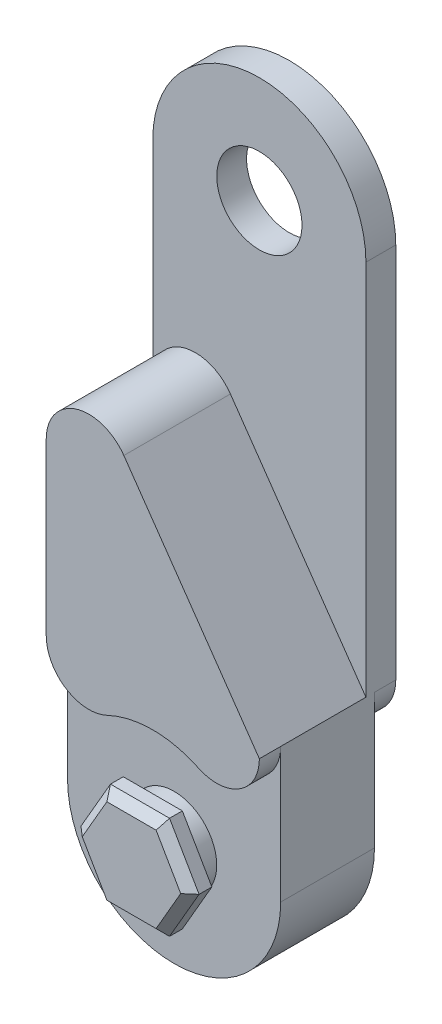
from build123d import *

# Parameters (mm, degrees)
CROQUIS1_R              = 12.5
CROQUIS1_R_2            = 7.5
CROQUIS1_R_3            = 5
SALIENTE_EXTRUIR2_DEPTH = 16
CROQUIS2_R              = 12.5
CROQUIS2_R_2            = 5
CORTAR_EXTRUIR1_DEPTH   = 2.5
REDONDEO2_R             = 5
REDONDEO3_R             = 5
CORTAR_EXTRUIR3_START   = -2.5
CROQUIS3_R              = 12.5
CROQUIS3_R_2            = 5
CORTAR_EXTRUIR3_DEPTH   = 2.5
REDONDEO6_R             = 5
REDONDEO7_R             = 5
SALIENTE_EXTRUIR3_DEPTH = 2.5
SALIENTE_EXTRUIR4_DEPTH = 2.5
CHAFL_N2_SIZE           = 1
CHAFL_N3_SIZE           = 1
CHAFL_N4_SIZE           = 1
CHAFL_N5_SIZE           = 1
CHAFL_N6_SIZE           = 1
CHAFL_N7_SIZE           = 1
CHAFL_N8_SIZE           = 1
CHAFL_N9_SIZE           = 1
CHAFL_N10_SIZE          = 1
CHAFL_N11_SIZE          = 1
CHAFL_N12_SIZE          = 1
CHAFL_N13_SIZE          = 1
CORTAR_EXTRUIR4_START   = -12.5
CORTAR_EXTRUIR4_DEPTH   = 12.5
REDONDEO8_START         = 3.5
REDONDEO8_DEPTH         = 13.5
REDONDEO9_START         = 3.5
REDONDEO9_DEPTH         = 13.5
CORTAR_EXTRUIR5_DEPTH   = 12.5
CORTAR_EXTRUIR6_START   = -12.5
CORTAR_EXTRUIR6_DEPTH   = 12.5
REDONDEO11_R            = 5


with BuildPart() as part:
    # Croquis1 → Saliente-Extruir2 (new body)
    with BuildSketch(Plane.XY):
        with BuildLine():
            ThreePointArc((12.5, 30), (0, 42.5), (-12.5, 30))
            Line((-12.5, 30), (-5, 30))
            ThreePointArc((-5, 30), (0, 35), (5, 30))
            Line((5, 30), (12.5, 30))
        make_face()
        with BuildLine():
            ThreePointArc((5, 30), (0, 35), (-5, 30))
            Line((-5, 30), (5, 30))
        make_face()
        with BuildLine():
            Line((5, 30), (-5, 30))
            ThreePointArc((-5, 30), (0, 25), (5, 30))
        make_face()
        with BuildLine():
            ThreePointArc((-12.5, 30), (-11.180339887, 24.409830056), (-7.5, 20))
            Line((-7.5, 20), (7.5, 20))
            ThreePointArc((7.5, 20), (11.180339887, 24.409830056), (12.5, 30))
            Line((12.5, 30), (5, 30))
            ThreePointArc((5, 30), (0, 25), (-5, 30))
            Line((-5, 30), (-12.5, 30))
        make_face()
        with BuildLine():
            Line((7.5, 20), (-7.5, 20))
            ThreePointArc((-7.5, 20), (0, 17.5), (7.5, 20))
        make_face()
        with BuildLine():
            ThreePointArc((-12.5, -30), (-11.180339887, -24.409830056), (-7.5, -20))
            Line((-7.5, -20), (-7.5, 20))
            ThreePointArc((-7.5, 20), (-11.180339887, 24.409830056), (-12.5, 30))
            Line((-12.5, 30), (-12.5, -30))
        make_face()
        with BuildLine():
            Line((7.5, 20), (7.5, -20))
            ThreePointArc((7.5, -20), (11.180339887, -24.409830056), (12.5, -30))
            Line((12.5, -30), (12.5, 30))
            ThreePointArc((12.5, 30), (11.180339887, 24.409830056), (7.5, 20))
        make_face()
        with BuildLine():
            Line((-7.5, 20), (-7.5, -20))
            ThreePointArc((-7.5, -20), (0, -12.5), (7.5, -20))
            Line((7.5, -20), (7.5, 20))
            ThreePointArc((7.5, 20), (0, 17.5), (-7.5, 20))
        make_face()
        with Locations((0, -30)):
            Circle(CROQUIS1_R)
        with Locations((0, -20)):
            Circle(CROQUIS1_R_2)
        with BuildLine():
            ThreePointArc((7.5, -20), (0, -17.5), (-7.5, -20))
            Line((-7.5, -20), (7.5, -20))
        make_face()
        with BuildLine():
            Line((7.5, -20), (-7.5, -20))
            ThreePointArc((-7.5, -20), (-6.460724191, -23.809073762), (-3.630921887, -26.5625))
            ThreePointArc((-3.630921887, -26.5625), (0, -25), (3.630921887, -26.5625))
            ThreePointArc((3.630921887, -26.5625), (6.460724191, -23.809073762), (7.5, -20))
        make_face()
        with BuildLine():
            ThreePointArc((-3.630921887, -26.5625), (-6.460724191, -23.809073762), (-7.5, -20))
            ThreePointArc((-7.5, -20), (-11.180339887, -24.409830056), (-12.5, -30))
            Line((-12.5, -30), (-5, -30))
            ThreePointArc((-5, -30), (-4.64513775, -28.149947222), (-3.630921887, -26.5625))
        make_face()
        with BuildLine():
            ThreePointArc((12.5, -30), (11.180339887, -24.409830056), (7.5, -20))
            ThreePointArc((7.5, -20), (6.460724191, -23.809073762), (3.630921887, -26.5625))
            ThreePointArc((3.630921887, -26.5625), (4.64513775, -28.149947222), (5, -30))
            Line((5, -30), (12.5, -30))
        make_face()
        with BuildLine():
            Line((-5, -30), (-12.5, -30))
            ThreePointArc((-12.5, -30), (0, -42.5), (12.5, -30))
            Line((12.5, -30), (5, -30))
            ThreePointArc((5, -30), (0, -35), (-5, -30))
        make_face()
        with Locations((0, -30)):
            Circle(CROQUIS1_R_3)
        with BuildLine():
            ThreePointArc((3.630921887, -26.5625), (0, -27.5), (-3.630921887, -26.5625))
            ThreePointArc((-3.630921887, -26.5625), (-4.64513775, -28.149947222), (-5, -30))
            Line((-5, -30), (5, -30))
            ThreePointArc((5, -30), (4.64513775, -28.149947222), (3.630921887, -26.5625))
        make_face()
        with BuildLine():
            Line((5, -30), (-5, -30))
            ThreePointArc((-5, -30), (0, -35), (5, -30))
        make_face()
    extrude(amount=SALIENTE_EXTRUIR2_DEPTH)

    # Croquis2 → Cortar-Extruir1 (cut)
    with BuildSketch(Plane(origin=(0, 0, 0), x_dir=(-1, 0, 0), z_dir=(0, 0, -1))):
        with Locations((0, -30)):
            Circle(CROQUIS2_R)
        with Locations((0, -30)):
            Circle(CROQUIS2_R_2, mode=Mode.SUBTRACT)
    extrude(amount=-CORTAR_EXTRUIR1_DEPTH, mode=Mode.SUBTRACT)

    # Redondeo2
    redondeo2_edges = [part.edges().sort_by_distance(p)[0] for p in [
        (12.5, -30, 1.25),
    ]]
    fillet(redondeo2_edges, radius=REDONDEO2_R)

    # Redondeo3
    redondeo3_edges = [part.edges().sort_by_distance(p)[0] for p in [
        (-12.5, -30, 1.25),
    ]]
    fillet(redondeo3_edges, radius=REDONDEO3_R)

    # Croquis3 → Cortar-Extruir3 (cut)
    with BuildSketch(Plane.XY.offset(16).offset(CORTAR_EXTRUIR3_START)):
        with Locations((0, -30)):
            Circle(CROQUIS3_R)
        with Locations(Location((0, -30, 0), (0, 0, 180))):
            Circle(CROQUIS3_R_2, mode=Mode.SUBTRACT)
    extrude(amount=CORTAR_EXTRUIR3_DEPTH, mode=Mode.SUBTRACT)

    # Redondeo6
    redondeo6_edges = [part.edges().sort_by_distance(p)[0] for p in [
        (12.5, -30, 14.75),
    ]]
    fillet(redondeo6_edges, radius=REDONDEO6_R)

    # Redondeo7
    redondeo7_edges = [part.edges().sort_by_distance(p)[0] for p in [
        (-12.5, -30, 14.75),
    ]]
    fillet(redondeo7_edges, radius=REDONDEO7_R)

    # Croquis4 → Saliente-Extruir3 (add)
    with BuildSketch(Plane.XY.offset(16)):
        Polygon((6.92820323, -30), (3.464101615, -24), (-3.464101615, -24), (-6.92820323, -30), (-3.464101615, -36), (3.464101615, -36), align=None)
    extrude(amount=SALIENTE_EXTRUIR3_DEPTH)

    # Croquis5 → Saliente-Extruir4 (add)
    with BuildSketch(Plane(origin=(0, 0, 0), x_dir=(-1, 0, 0), z_dir=(0, 0, -1))):
        Polygon((6.92820323, -30), (3.464101615, -24), (-3.464101615, -24), (-6.92820323, -30), (-3.464101615, -36), (3.464101615, -36), align=None)
    extrude(amount=SALIENTE_EXTRUIR4_DEPTH)

    # Chaflán2
    chafl_n2_edges = [part.edges().sort_by_distance(p)[0] for p in [
        (5.196152423, -33, 18.5),
    ]]
    chamfer(chafl_n2_edges, length=CHAFL_N2_SIZE)

    # Chaflán3
    chafl_n3_edges = [part.edges().sort_by_distance(p)[0] for p in [
        (4.907477288, -26.5, 18.5),
    ]]
    chamfer(chafl_n3_edges, length=CHAFL_N3_SIZE)

    # Chaflán4
    chafl_n4_edges = [part.edges().sort_by_distance(p)[0] for p in [
        (-0.577350269, -24, 18.5),
    ]]
    chamfer(chafl_n4_edges, length=CHAFL_N4_SIZE)

    # Chaflán5
    chafl_n5_edges = [part.edges().sort_by_distance(p)[0] for p in [
        (-5.484827557, -27.5, 18.5),
    ]]
    chamfer(chafl_n5_edges, length=CHAFL_N5_SIZE)

    # Chaflán6
    chafl_n6_edges = [part.edges().sort_by_distance(p)[0] for p in [
        (-4.907477288, -33.5, 18.5),
    ]]
    chamfer(chafl_n6_edges, length=CHAFL_N6_SIZE)

    # Chaflán7
    chafl_n7_edges = [part.edges().sort_by_distance(p)[0] for p in [
        (0, -36, 18.5),
    ]]
    chamfer(chafl_n7_edges, length=CHAFL_N7_SIZE)

    # Chaflán8
    chafl_n8_edges = [part.edges().sort_by_distance(p)[0] for p in [
        (5.196152423, -33, -2.5),
    ]]
    chamfer(chafl_n8_edges, length=CHAFL_N8_SIZE)

    # Chaflán9
    chafl_n9_edges = [part.edges().sort_by_distance(p)[0] for p in [
        (4.907477288, -26.5, -2.5),
    ]]
    chamfer(chafl_n9_edges, length=CHAFL_N9_SIZE)

    # Chaflán10
    chafl_n10_edges = [part.edges().sort_by_distance(p)[0] for p in [
        (-0.577350269, -24, -2.5),
    ]]
    chamfer(chafl_n10_edges, length=CHAFL_N10_SIZE)

    # Chaflán11
    chafl_n11_edges = [part.edges().sort_by_distance(p)[0] for p in [
        (-5.484827557, -27.5, -2.5),
    ]]
    chamfer(chafl_n11_edges, length=CHAFL_N11_SIZE)

    # Chaflán12
    chafl_n12_edges = [part.edges().sort_by_distance(p)[0] for p in [
        (-4.907477288, -33.5, -2.5),
    ]]
    chamfer(chafl_n12_edges, length=CHAFL_N12_SIZE)

    # Chaflán13
    chafl_n13_edges = [part.edges().sort_by_distance(p)[0] for p in [
        (0, -36, -2.5),
    ]]
    chamfer(chafl_n13_edges, length=CHAFL_N13_SIZE)

    # Croquis6 → Cortar-Extruir4 (cut)
    with BuildSketch(Plane.XY.offset(16).offset(CORTAR_EXTRUIR4_START)):
        with BuildLine():
            ThreePointArc((12.5, 30), (0, 42.5), (-12.5, 30))
            Line((-12.5, 30), (12.5, 30))
        make_face()
        with BuildLine():
            Line((12.5, 30), (-12.5, 30))
            ThreePointArc((-12.5, 30), (0, 17.5), (12.5, 30))
        make_face()
        with BuildLine():
            Line((-12.5, 30), (12.5, 30))
            ThreePointArc((12.5, 30), (0, 42.5), (-12.5, 30))
        make_face()
    extrude(amount=CORTAR_EXTRUIR4_DEPTH, mode=Mode.SUBTRACT)

    # Redondeo8: read off the stored shape, not the designer's step
    # Redondeo8 outline → Redondeo8 (cut)
    with BuildSketch(Plane.XY.offset(REDONDEO8_START)):
        with BuildLine():
            ThreePointArc((-12.5, 14.188611699), (-10.172612419, 18.414382973), (-5.357142857, 18.706151214))
            ThreePointArc((-5.357142857, 18.706151214), (-10.564428184, 23.318468952), (-12.5, 30))
            Line((-12.5, 30), (-12.5, 14.188611699))
        make_face()
    extrude(amount=REDONDEO8_DEPTH, mode=Mode.SUBTRACT)

    # Redondeo9: read off the stored shape, not the designer's step
    # Redondeo9 outline → Redondeo9 (cut)
    with BuildSketch(Plane.XY.offset(REDONDEO9_START)):
        with BuildLine():
            ThreePointArc((5.357142857, 18.706151214), (10.172612419, 18.414382973), (12.5, 14.188611699))
            Line((12.5, 14.188611699), (12.5, 30))
            ThreePointArc((12.5, 30), (10.564428184, 23.318468952), (5.357142857, 18.706151214))
        make_face()
    extrude(amount=REDONDEO9_DEPTH, mode=Mode.SUBTRACT)

    # Croquis7 → Cortar-Extruir5 (cut)
    with BuildSketch(Plane.XY.offset(3.5)):
        with BuildLine():
            ThreePointArc((5, 30), (0, 35), (-5, 30))
            Line((-5, 30), (5, 30))
        make_face()
        with BuildLine():
            Line((5, 30), (-5, 30))
            ThreePointArc((-5, 30), (0, 25), (5, 30))
        make_face()
    extrude(amount=-CORTAR_EXTRUIR5_DEPTH, mode=Mode.SUBTRACT)

    # Croquis8 → Cortar-Extruir6 (cut)
    with BuildSketch(Plane.XY.offset(16).offset(CORTAR_EXTRUIR6_START)):
        with BuildLine():
            Line((-10.172612419, 18.414382973), (12.5, -14.188611699))
            Line((12.5, -14.188611699), (12.5, 14.188611699))
            ThreePointArc((12.5, 14.188611699), (10.172612419, 18.414382973), (5.357142857, 18.706151214))
            ThreePointArc((5.357142857, 18.706151214), (0, 17.5), (-5.357142857, 18.706151214))
            ThreePointArc((-5.357142857, 18.706151214), (-7.802394345, 19.179459088), (-10.172612419, 18.414382973))
        make_face()
    extrude(amount=CORTAR_EXTRUIR6_DEPTH, mode=Mode.SUBTRACT)

    # Redondeo11
    # the kernel refuses this fillet: 5 mm, written as the material it takes off along each edge
    with BuildSketch(Plane(origin=(-10.172612419, 18.414382973, 3.5), x_dir=(-0.181629701396011, -0.9833669973976125, 0), z_dir=(0, 0, 1))) as redondeo11_piece_1:
        with BuildLine():
            CenterArc((11.905766635, 4.916834987), REDONDEO11_R, 135.280031418, 145.184668291)
            Line((8.352995208, 8.435046918), (7.997718065, 8.786868111))
            Line((7.997718065, 8.786868111), (-0.355277143, 0.351821193))
            Line((-0.355277143, 0.351821193), (-0.367005821, -0.339568442))
            ThreePointArc((-0.367005821, -0.339568442), (4.669021571, -2.012834061), (12.904729992, -0.491683499))
            Line((12.904729992, -0.491683499), (12.813915142, 0))
        make_face()
    extrude(amount=44.534787854, mode=Mode.SUBTRACT)


solid = part.part
